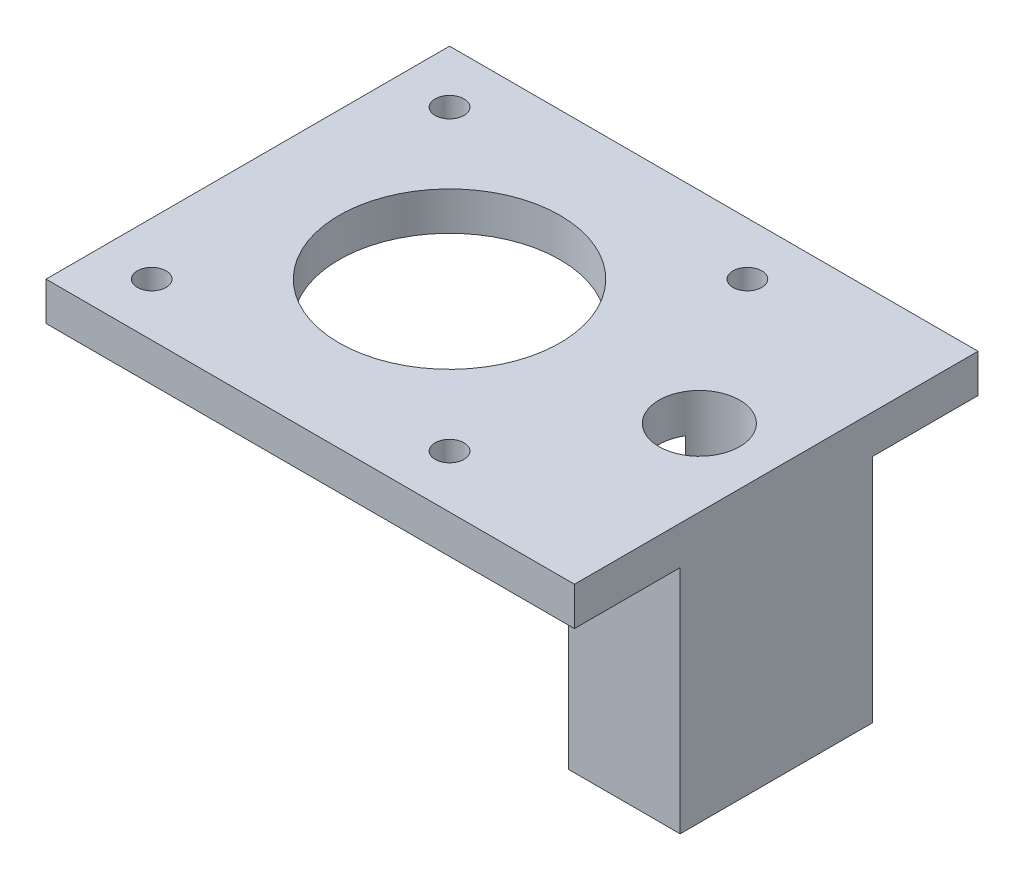
from build123d import *

# Parameters (mm, degrees)
SKETCH1_W           = 55
SKETCH1_H           = 42
SKETCH1_R           = 4.2
SKETCH1_R_2         = 11.5
SKETCH1_R_3         = 1.5
BOSS_EXTRUDE1_DEPTH = 4
BOSS_EXTRUDE2_START = 20
BOSS_EXTRUDE2_DEPTH = 20
SKETCH3_W           = 11.6
SKETCH3_H           = 20
BOSS_EXTRUDE3_DEPTH = 4


with BuildPart() as part:
    # Sketch1 → Boss-Extrude1 (new body)
    with BuildSketch(Plane(origin=(0, 0, 0), x_dir=(1, 0, 0), z_dir=(0, 1, 0))):
        with Locations((27.5, 21)):
            Rectangle(SKETCH1_W, SKETCH1_H)
        with Locations((47, 21)):
            Circle(SKETCH1_R, mode=Mode.SUBTRACT)
        with Locations((21, 21)):
            Circle(SKETCH1_R_2, mode=Mode.SUBTRACT)
        with Locations((5.5, 36.5)):
            Circle(SKETCH1_R_3, mode=Mode.SUBTRACT)
        with Locations((36.5, 36.5)):
            Circle(SKETCH1_R_3, mode=Mode.SUBTRACT)
        with Locations((5.5, 5.5)):
            Circle(SKETCH1_R_3, mode=Mode.SUBTRACT)
        with Locations((36.5, 5.5)):
            Circle(SKETCH1_R_3, mode=Mode.SUBTRACT)
    extrude(amount=BOSS_EXTRUDE1_DEPTH)

    # Sketch2 → Boss-Extrude2 (add)
    with BuildSketch(Plane.XZ.offset(BOSS_EXTRUDE2_START)):
        with BuildLine():
            Line((55, -11), (43.4, -11))
            Line((43.4, -11), (43.4, -18.836669235))
            ThreePointArc((43.4, -18.836669235), (51.2, -21), (43.4, -23.163330765))
            Line((43.4, -23.163330765), (43.4, -31))
            Line((43.4, -31), (55, -31))
            Line((55, -31), (55, -11))
        make_face()
    extrude(amount=-BOSS_EXTRUDE2_DEPTH)

    # Sketch3 → Boss-Extrude3 (add)
    with BuildSketch(Plane.XZ.offset(20)):
        with Locations((49.2, -21)):
            Rectangle(SKETCH3_W, SKETCH3_H)
    extrude(amount=BOSS_EXTRUDE3_DEPTH)


solid = part.part
